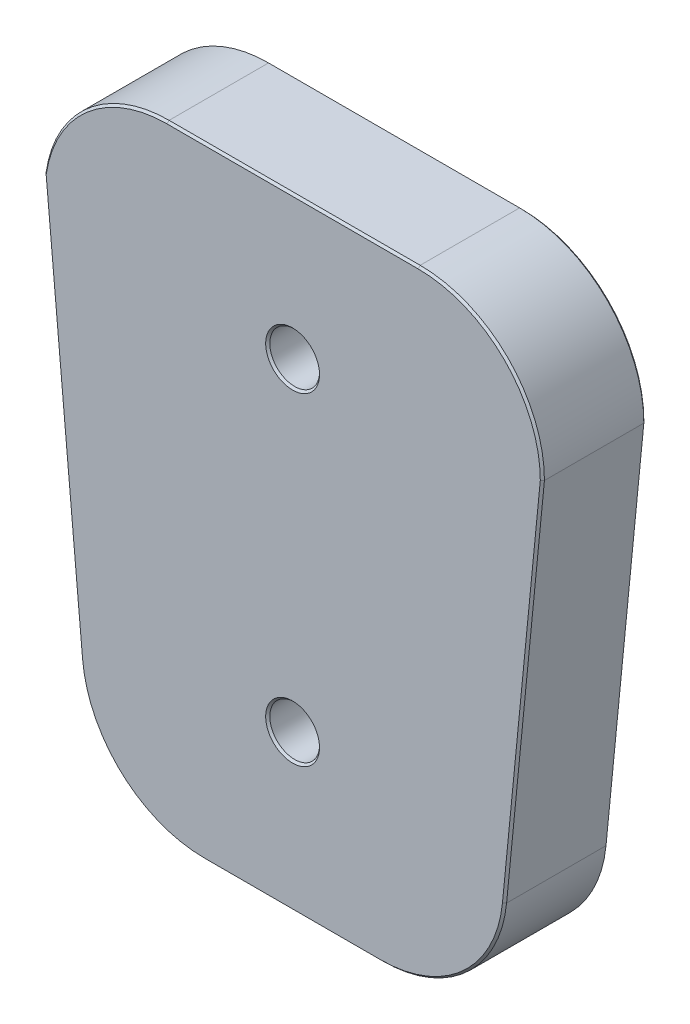
from build123d import *

# Parameters (mm, degrees)
BOSS_EXTRUDE1_DEPTH = 25
SKETCH4_R           = 6
CUT_EXTRUDE1_DEPTH  = 12
SKETCH5_R           = 3.2
CUT_EXTRUDE2_DEPTH  = 193.726734542
CHAMFER1_SIZE       = 0.5


with BuildPart() as part:
    # Sketch3 → Boss-Extrude1 (new body)
    with BuildSketch(Plane.XY):
        with BuildLine():
            Line((0, -25.695570819), (8.806669266, -122.712097135))
            ThreePointArc((8.806669266, -122.712097135), (18.452204227, -142.151330818), (38.683826579, -150))
            Line((38.683826579, -150), (81.316173421, -150))
            ThreePointArc((81.316173421, -150), (101.46473628, -142.226907448), (111.172189547, -122.935694313))
            Line((111.172189547, -122.935694313), (120.310407726, -30))
            ThreePointArc((120.310407726, -30), (111.523611161, -8.786796564), (90.310407726, 0))
            Line((90.310407726, 0), (29.689592274, 0))
            ThreePointArc((29.689592274, 0), (10.057130323, -7.315943094), (0, -25.695570819))
        make_face()
    extrude(amount=BOSS_EXTRUDE1_DEPTH)

    # Sketch4 → Cut-Extrude1 (cut)
    with BuildSketch(Plane.XY.offset(25)):
        with Locations((60, -34.5)):
            Circle(SKETCH4_R)
        with Locations((60, -112.5)):
            Circle(SKETCH4_R)
    extrude(amount=-CUT_EXTRUDE1_DEPTH, mode=Mode.SUBTRACT)

    # Sketch5 → Cut-Extrude2 (cut, through all)
    with BuildSketch(Plane.XY.offset(13)):
        with Locations((60, -34.5)):
            Circle(SKETCH5_R)
        with Locations((60, -112.5)):
            Circle(SKETCH5_R)
    extrude(amount=-CUT_EXTRUDE2_DEPTH, mode=Mode.SUBTRACT)

    # Chamfer1
    # the kernel refuses this chamfer: 0.5 mm, written as the material it takes off along each edge
    with BuildSketch(Plane(origin=(81.316173421, -120, 0), x_dir=(0, -1, 0), z_dir=(-1, 0, 0))) as chamfer1_piece_1:
        Polygon((30 - CHAMFER1_SIZE, 0), (30, CHAMFER1_SIZE), (30, 0), align=None)
    revolve(axis=Axis((81.316173421, -120, 0), (0, 0, 1)), revolution_arc=84.384249791, mode=Mode.SUBTRACT)
    with BuildSketch(Plane(origin=(38.683826579, -150, 0), x_dir=(0, 0.9996219169112968, -0.027495876610586483), z_dir=(1, 0, 0))) as chamfer1_piece_2:
        Polygon((CHAMFER1_SIZE * 0.999621916911, CHAMFER1_SIZE * 0.0274958766106), (-CHAMFER1_SIZE * 0.0274958766106, CHAMFER1_SIZE * 0.999621916911), (0, 0), align=None)
    extrude(amount=42.632346842, mode=Mode.SUBTRACT)
    with BuildSketch(Plane(origin=(38.683826579, -120, 0), x_dir=(-0.9959052437808521, -0.09040323782808642, 0), z_dir=(-0.09040323782808642, 0.9959052437808521, 0))) as chamfer1_piece_3:
        Polygon((30, CHAMFER1_SIZE), (30 - CHAMFER1_SIZE, 0), (30, 0), align=None)
    revolve(axis=Axis((38.683826579, -120, 0), (0, 0, 1)), revolution_arc=84.813194516, mode=Mode.SUBTRACT)
    with BuildSketch(Plane(origin=(-0.116244234, -24.414994532, 0), x_dir=(-0.027383287698834344, -0.0024857162725187313, 0.9996219169112968), z_dir=(0.09040323782809233, -0.9959052437808515, 0))) as chamfer1_piece_4:
        Polygon((CHAMFER1_SIZE * 0.999621916911, -CHAMFER1_SIZE * 0.0274958766106), (-CHAMFER1_SIZE * 0.0274958766106, -CHAMFER1_SIZE * 0.999621916911), (0, 0), align=None)
    extrude(amount=98.701260202, mode=Mode.SUBTRACT)
    with BuildSketch(Plane(origin=(38.683826579, -150, 25), x_dir=(0, 0.9996219169112968, 0.027495876610589196), z_dir=(1, 0, 0))) as chamfer1_piece_5:
        Polygon((CHAMFER1_SIZE * 0.999621916911, -CHAMFER1_SIZE * 0.0274958766106), (-CHAMFER1_SIZE * 0.0274958766106, -CHAMFER1_SIZE * 0.999621916911), (0, 0), align=None)
    extrude(amount=42.632346842, mode=Mode.SUBTRACT)
    with BuildSketch(Plane(origin=(81.316173421, -120, 25), x_dir=(0, -1, 0), z_dir=(-1, 0, 0))) as chamfer1_piece_6:
        Polygon((30 - CHAMFER1_SIZE, 0), (30, -CHAMFER1_SIZE), (30, 0), align=None)
    revolve(axis=Axis((81.316173421, -120, 25), (0, 0, 1)), revolution_arc=84.384249791, mode=Mode.SUBTRACT)
    with BuildSketch(Plane(origin=(111.172189547, -122.935694313, 25), x_dir=(-0.9948242690303891, 0.09781947923377807, 0.027495876610589255), z_dir=(0.09785647711289452, 0.9952005375234951, 0))) as chamfer1_piece_7:
        Polygon((CHAMFER1_SIZE * 0.999621916911, -CHAMFER1_SIZE * 0.0274958766106), (-CHAMFER1_SIZE * 0.0274958766106, -CHAMFER1_SIZE * 0.999621916911), (0, 0), align=None)
    extrude(amount=94.669728268, mode=Mode.SUBTRACT)
    with BuildSketch(Plane(origin=(90.310407726, -30, 25), x_dir=(0.9990808536319631, -0.04286546285796977, 0), z_dir=(-0.04286546285796977, -0.9990808536319631, 0))) as chamfer1_piece_8:
        Polygon((30 - CHAMFER1_SIZE, 0), (30, -CHAMFER1_SIZE), (30, 0), align=None)
    revolve(axis=Axis((90.310407726, -30, 25), (0, 0, 1)), revolution_arc=92.456762863, mode=Mode.SUBTRACT)
    with BuildSketch(Plane(origin=(60, -34.5, 25), x_dir=(1, 0, 0), z_dir=(0, -1, 0))) as chamfer1_piece_9:
        Polygon((6 + CHAMFER1_SIZE, 0), (6, -CHAMFER1_SIZE), (6, 0), align=None)
    revolve(axis=Axis((60, -34.5, 25), (0, 0, 1)), mode=Mode.SUBTRACT)
    with BuildSketch(Plane(origin=(90.310407726, 0, 25), x_dir=(0, -0.9996219169112968, 0.027495876610589425), z_dir=(-1, 0, 0))) as chamfer1_piece_10:
        Polygon((CHAMFER1_SIZE * 0.999621916911, -CHAMFER1_SIZE * 0.0274958766106), (-CHAMFER1_SIZE * 0.0274958766106, -CHAMFER1_SIZE * 0.999621916911), (0, 0), align=None)
    extrude(amount=60.620815451, mode=Mode.SUBTRACT)
    with BuildSketch(Plane(origin=(60, -112.5, 25), x_dir=(1, 0, 0), z_dir=(0, -1, 0))) as chamfer1_piece_11:
        Polygon((6 + CHAMFER1_SIZE, 0), (6, -CHAMFER1_SIZE), (6, 0), align=None)
    revolve(axis=Axis((60, -112.5, 25), (0, 0, 1)), mode=Mode.SUBTRACT)
    with BuildSketch(Plane(origin=(29.689592274, -30, 25), x_dir=(0, 1, 0), z_dir=(1, 0, 0))) as chamfer1_piece_12:
        Polygon((30, -CHAMFER1_SIZE), (30 - CHAMFER1_SIZE, 0), (30, 0), align=None)
    revolve(axis=Axis((29.689592274, -30, 25), (0, 0, 1)), revolution_arc=84.2072647, mode=Mode.SUBTRACT)
    with BuildSketch(Plane(origin=(60, -34.5, 0), x_dir=(1, 0, 0), z_dir=(0, -1, 0))) as chamfer1_piece_13:
        Polygon((3.2 + CHAMFER1_SIZE, 0), (3.2, CHAMFER1_SIZE), (3.2, 0), align=None)
    revolve(axis=Axis((60, -34.5, 0), (0, 0, 1)), mode=Mode.SUBTRACT)
    with BuildSketch(Plane(origin=(60, -112.5, 0), x_dir=(1, 0, 0), z_dir=(0, -1, 0))) as chamfer1_piece_14:
        Polygon((3.2 + CHAMFER1_SIZE, 0), (3.2, CHAMFER1_SIZE), (3.2, 0), align=None)
    revolve(axis=Axis((60, -112.5, 0), (0, 0, 1)), mode=Mode.SUBTRACT)
    with BuildSketch(Plane(origin=(-0.116244234, -24.414994532, 25), x_dir=(-0.027383287698834274, -0.002485716272518725, -0.9996219169112968), z_dir=(0.09040323782809233, -0.9959052437808515, 0))) as chamfer1_piece_15:
        Polygon((CHAMFER1_SIZE * 0.999621916911, CHAMFER1_SIZE * 0.0274958766106), (-CHAMFER1_SIZE * 0.0274958766106, CHAMFER1_SIZE * 0.999621916911), (0, 0), align=None)
    extrude(amount=98.701260202, mode=Mode.SUBTRACT)
    with BuildSketch(Plane(origin=(29.689592274, -30, 0), x_dir=(0, 1, 0), z_dir=(1, 0, 0))) as chamfer1_piece_16:
        Polygon((30, CHAMFER1_SIZE), (30 - CHAMFER1_SIZE, 0), (30, 0), align=None)
    revolve(axis=Axis((29.689592274, -30, 0), (0, 0, 1)), revolution_arc=84.2072647, mode=Mode.SUBTRACT)
    with BuildSketch(Plane(origin=(38.683826579, -120, 25), x_dir=(-0.9959052437808521, -0.09040323782808642, 0), z_dir=(-0.09040323782808642, 0.9959052437808521, 0))) as chamfer1_piece_17:
        Polygon((30, -CHAMFER1_SIZE), (30 - CHAMFER1_SIZE, 0), (30, 0), align=None)
    revolve(axis=Axis((38.683826579, -120, 25), (0, 0, 1)), revolution_arc=84.813194516, mode=Mode.SUBTRACT)
    with BuildSketch(Plane(origin=(90.310407726, 0, 0), x_dir=(0, -0.9996219169112968, -0.027495876610586893), z_dir=(-1, 0, 0))) as chamfer1_piece_18:
        Polygon((CHAMFER1_SIZE * 0.999621916911, CHAMFER1_SIZE * 0.0274958766106), (-CHAMFER1_SIZE * 0.0274958766106, CHAMFER1_SIZE * 0.999621916911), (0, 0), align=None)
    extrude(amount=60.620815451, mode=Mode.SUBTRACT)
    with BuildSketch(Plane(origin=(90.310407726, -30, 0), x_dir=(0.9990808536319631, -0.04286546285796977, 0), z_dir=(-0.04286546285796977, -0.9990808536319631, 0))) as chamfer1_piece_19:
        Polygon((30 - CHAMFER1_SIZE, 0), (30, CHAMFER1_SIZE), (30, 0), align=None)
    revolve(axis=Axis((90.310407726, -30, 0), (0, 0, 1)), revolution_arc=92.456762863, mode=Mode.SUBTRACT)
    with BuildSketch(Plane(origin=(111.172189547, -122.935694313, 0), x_dir=(-0.9948242690303891, 0.09781947923377807, -0.02749587661058666), z_dir=(0.09785647711289452, 0.9952005375234951, 0))) as chamfer1_piece_20:
        Polygon((CHAMFER1_SIZE * 0.999621916911, CHAMFER1_SIZE * 0.0274958766106), (-CHAMFER1_SIZE * 0.0274958766106, CHAMFER1_SIZE * 0.999621916911), (0, 0), align=None)
    extrude(amount=94.669728268, mode=Mode.SUBTRACT)


solid = part.part
